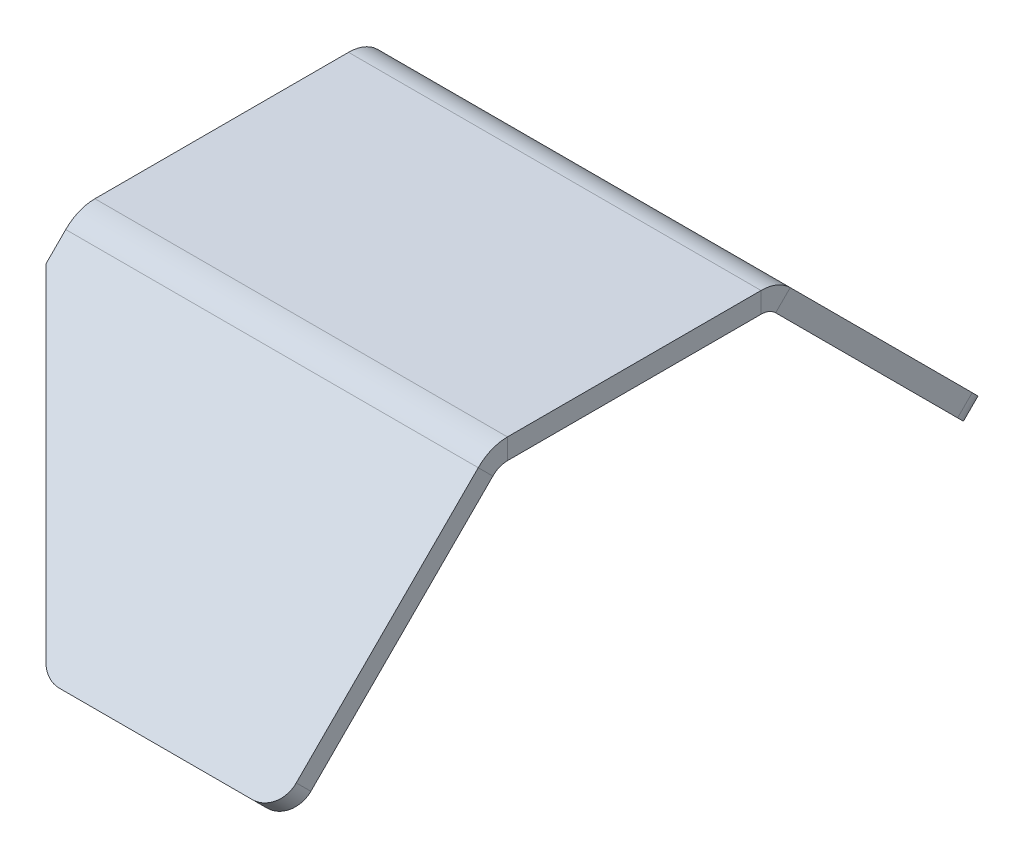
from build123d import *

# Parameters (mm, degrees)
SM_BASE_FLANGE_1_DEPTH = 160
CUT_EXTRUDE_START      = 3.884627654
CUT_EXTRUDE_1_DEPTH    = 98.974499311
FILLET_1_R             = 10


# Read off the part's stored shape, not the designer's step: 切除-拉伸1
# Sheet-metal steps are written as plain solids
with BuildPart() as part:
    # Sketch 1 → 基体-法兰1 (new body)
    with BuildSketch(Plane(origin=(0, 0, 0), x_dir=(0, 0, -1), z_dir=(1, 0, 0))):
        with BuildLine():
            Line((-132.5, -80), (-54.843145751, -2.343145751))
            ThreePointArc((-54.843145751, -2.343145751), (-52.24775896, -0.60896374), (-49.186291501, 0))
            Line((-49.186291501, 0), (49.186291501, 0))
            ThreePointArc((49.186291501, 0), (52.24775896, -0.60896374), (54.843145751, -2.343145751))
            Line((54.843145751, -2.343145751), (132.5, -80))
            Line((132.5, -80), (138.156854249, -74.343145751))
            Line((138.156854249, -74.343145751), (60.5, 3.313708499))
            ThreePointArc((60.5, 3.313708499), (55.309226419, 6.78207252), (49.186291501, 8))
            Line((49.186291501, 8), (-49.186291501, 8))
            ThreePointArc((-49.186291501, 8), (-55.309226419, 6.78207252), (-60.5, 3.313708499))
            Line((-60.5, 3.313708499), (-138.156854249, -74.343145751))
            Line((-138.156854249, -74.343145751), (-132.5, -80))
        make_face()
    extrude(amount=SM_BASE_FLANGE_1_DEPTH)

    # 切除-拉伸1 outline → 切除-拉伸1 (cut)
    with BuildSketch(Plane(origin=(0, 0, 0), x_dir=(0.8944271909999176, 0.4472135954999543, 0), z_dir=(0.4472135954999544, -0.8944271909999175, 0)).offset(CUT_EXTRUDE_START)):
        Polygon((-32.422985674, 0), (-4.472135955, 62.5), (29.362637858, 138.156854249), (30.186917696, 140), (-36, 140), (-36, 7.99844719), align=None)
        Polygon((-4.472135955, -62.5), (-32.422985674, 0), (-36, -7.99844719), (-36, -140), (30.186917696, -140), (29.362637858, -138.156854249), align=None)
    extrude(amount=CUT_EXTRUDE_1_DEPTH, mode=Mode.SUBTRACT)

    # 圆角1
    fillet_1_edges = [part.edges().sort_by_distance(p)[0] for p in [
        (160, -77.171572875, -135.328427125),
        (70, -77.171572875, 135.328427125),
        (70, -77.171572875, -135.328427125),
        (160, -77.171572875, 135.328427125),
    ]]
    fillet(fillet_1_edges, radius=FILLET_1_R)


solid = part.part
